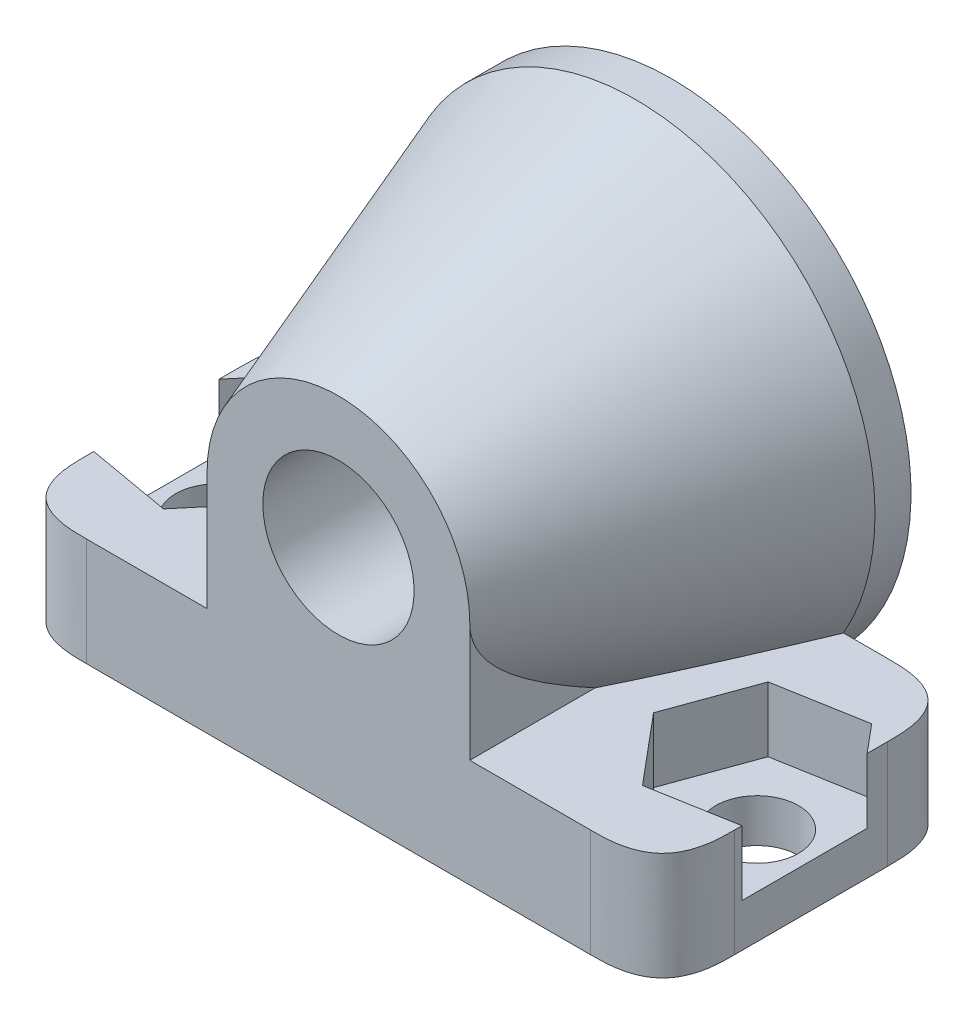
from build123d import *

# Parameters (mm, degrees)
SKETCH1_R               = 6.65
BOSS_EXTRUDE1_DEPTH     = 8.25
BOSS_EXTRUDE1_TAPER     = 20
SKETCH2_R               = 6.65
SKETCH2_R_2             = 5.45
BOSS_EXTRUDE2_DEPTH     = 1
SKETCH3_R               = 2.1
CUT_EXTRUDE1_DEPTH      = 13.51029576
CUT_EXTRUDE2_DEPTH      = 13.51029576
CUT_EXTRUDE2_DEPTH_BACK = 13.51029576
SKETCH4_W               = 15
SKETCH4_H               = 5
SKETCH5_R               = 2.1
BOSS_EXTRUDE3_DEPTH     = 8.25
CUT_EXTRUDE3_REACH      = 20.994
CUT_EXTRUDE3_START      = -1.2
CUT_EXTRUDE4_REACH      = 19.794
SKETCH7_R               = 1.15
FILLET1_SIZE            = 2


with BuildPart() as part:
    # Sketch1 → Boss-Extrude1 (new body)
    with BuildSketch(Plane.XY):
        Circle(SKETCH1_R)
    extrude(amount=BOSS_EXTRUDE1_DEPTH, taper=BOSS_EXTRUDE1_TAPER)

    # Sketch2 → Boss-Extrude2 (add)
    with BuildSketch(Plane(origin=(0, 0, 0), x_dir=(-1, 0, 0), z_dir=(0, 0, -1))):
        Circle(SKETCH2_R)
        Circle(SKETCH2_R_2, mode=Mode.SUBTRACT)
    extrude(amount=BOSS_EXTRUDE2_DEPTH)

    # Sketch3 → Cut-Extrude1 (cut, through all)
    with BuildSketch(Plane(origin=(0, 0, 0), x_dir=(-1, 0, 0), z_dir=(0, 0, -1))):
        Circle(SKETCH3_R)
    extrude(amount=-CUT_EXTRUDE1_DEPTH, mode=Mode.SUBTRACT)

    # Sketch4 → Cut-Extrude2 (cut, two sides: drawn at the far end of the back side and taken through both)
    with BuildSketch(Plane.XY.offset(-CUT_EXTRUDE2_DEPTH_BACK)):
        with Locations((0, -8.795)):
            Rectangle(SKETCH4_W, SKETCH4_H)
    extrude(amount=CUT_EXTRUDE2_DEPTH + CUT_EXTRUDE2_DEPTH_BACK, mode=Mode.SUBTRACT)

    # Sketch5 → Boss-Extrude3 (add)
    with BuildSketch(Plane.XY):
        with BuildLine():
            Line((3.647245567, 0), (3.647245567, -3.295))
            Line((3.647245567, -3.295), (9, -3.295))
            Line((9, -3.295), (9, -6.295))
            Line((9, -6.295), (-9, -6.295))
            Line((-9, -6.295), (-9, -3.295))
            Line((-9, -3.295), (-3.647245567, -3.295))
            Line((-3.647245567, -3.295), (-3.647245567, 0))
            ThreePointArc((-3.647245567, 0), (0, 3.647245567), (3.647245567, 0))
        make_face()
        with Locations(Location((0, 0, 0), (0, 0, 180))):
            Circle(SKETCH5_R, mode=Mode.SUBTRACT)
    extrude(amount=BOSS_EXTRUDE3_DEPTH)

    # Sketch6 → Cut-Extrude3 (cut, up to next)
    with BuildSketch(Plane.XZ.offset(6.295).offset(CUT_EXTRUDE3_START), mode=Mode.PRIVATE) as cut_extrude3_sk1:
        Polygon((-6.650898686, 6.457886687), (-9.095788478, 6.026786651), (-9.944889792, 3.693899965), (-8.349101314, 1.792113313), (-5.904211522, 2.223213349), (-5.055110208, 4.556100035), align=None)
    cut_extrude3_tool1 = extrude(cut_extrude3_sk1.sketch, amount=-CUT_EXTRUDE3_REACH, mode=Mode.PRIVATE) & part.part
    # Sketch6 → Cut-Extrude3 (cut, up to next)
    with BuildSketch(Plane.XZ.offset(6.295).offset(CUT_EXTRUDE3_START), mode=Mode.PRIVATE) as cut_extrude3_sk2:
        Polygon((6.650898686, 6.457886687), (5.055110208, 4.556100035), (5.904211522, 2.223213349), (8.349101314, 1.792113313), (9.944889792, 3.693899965), (9.095788478, 6.026786651), align=None)
    cut_extrude3_tool2 = extrude(cut_extrude3_sk2.sketch, amount=-CUT_EXTRUDE3_REACH, mode=Mode.PRIVATE) & part.part
    add(cut_extrude3_tool1.solids().sort_by_distance((-7.5, -5.095, 4.125))[0], mode=Mode.SUBTRACT)
    add(cut_extrude3_tool2.solids().sort_by_distance((7.5, -5.095, 4.125))[0], mode=Mode.SUBTRACT)

    # Sketch7 → Cut-Extrude4 (cut, up to next)
    with BuildSketch(Plane.XZ.offset(6.295), mode=Mode.PRIVATE) as cut_extrude4_sk1:
        with Locations((7.5, 4.125)):
            Circle(SKETCH7_R)
    cut_extrude4_tool1 = extrude(cut_extrude4_sk1.sketch, amount=-CUT_EXTRUDE4_REACH, mode=Mode.PRIVATE) & part.part
    # Sketch7 → Cut-Extrude4 (cut, up to next)
    with BuildSketch(Plane.XZ.offset(6.295), mode=Mode.PRIVATE) as cut_extrude4_sk2:
        with Locations((-7.5, 4.125)):
            Circle(SKETCH7_R)
    cut_extrude4_tool2 = extrude(cut_extrude4_sk2.sketch, amount=-CUT_EXTRUDE4_REACH, mode=Mode.PRIVATE) & part.part
    add(cut_extrude4_tool1.solids().sort_by_distance((7.5, -6.295, 4.125))[0], mode=Mode.SUBTRACT)
    add(cut_extrude4_tool2.solids().sort_by_distance((-7.5, -6.295, 4.125))[0], mode=Mode.SUBTRACT)

    # Fillet1
    # a fillet whose section is not a circle: 2 mm, written as the material it takes off along each edge
    with BuildSketch(Plane(origin=(9, 1.705, 0), x_dir=(0, 0, 1), z_dir=(0, -1, 0)), Plane(origin=(9, 1.705, 8.25), x_dir=(-1, 0, 0), z_dir=(0, -1, 0)), Plane(origin=(-9, -11.295, 0), x_dir=(0, 0, 1), z_dir=(0, 1, 0)), Plane(origin=(-9, -11.295, 8.25), x_dir=(1, 0, 0), z_dir=(0, 1, 0))) as fillet1_piece_1:
        with BuildLine():
            add(Edge.make_bspline([(FILLET1_SIZE, 0), (FILLET1_SIZE * 0.831801948466, 0), (FILLET1_SIZE * 0.663603896932, 0), (FILLET1_SIZE * 0.292893218813, FILLET1_SIZE * 0.0716919198361), (FILLET1_SIZE * 0.0716919198361, FILLET1_SIZE * 0.292893218813), (0, FILLET1_SIZE * 0.663603896932), (0, FILLET1_SIZE * 0.831801948466), (0, FILLET1_SIZE)], knots=[0, 0, 0, 0, 0, 0, 0.5, 0.5, 1, 1, 1, 1, 1, 1], degree=5))
            Line((0, FILLET1_SIZE), (0, 0))
            Line((0, 0), (FILLET1_SIZE, 0))
        make_face()
    extrude(amount=13, mode=Mode.SUBTRACT)


solid = part.part
